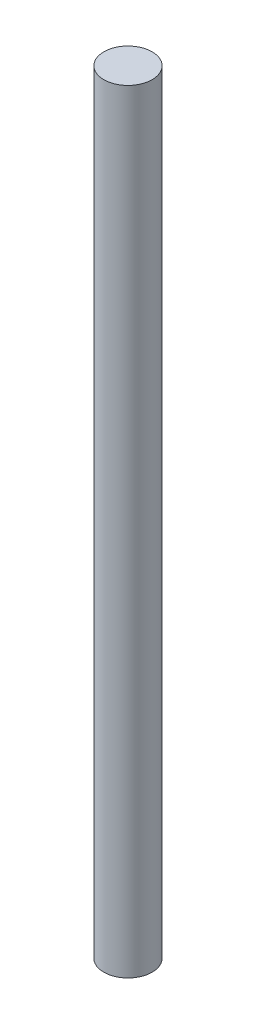
from build123d import *

# Parameters (mm, degrees)
SKETCH1_R           = 3
BOSS_EXTRUDE1_DEPTH = 96


with BuildPart() as part:
    # Sketch1 → Boss-Extrude1 (new body)
    with BuildSketch(Plane(origin=(0, 0, 0), x_dir=(1, 0, 0), z_dir=(0, 1, 0))):
        Circle(SKETCH1_R)
    extrude(amount=BOSS_EXTRUDE1_DEPTH)


solid = part.part
